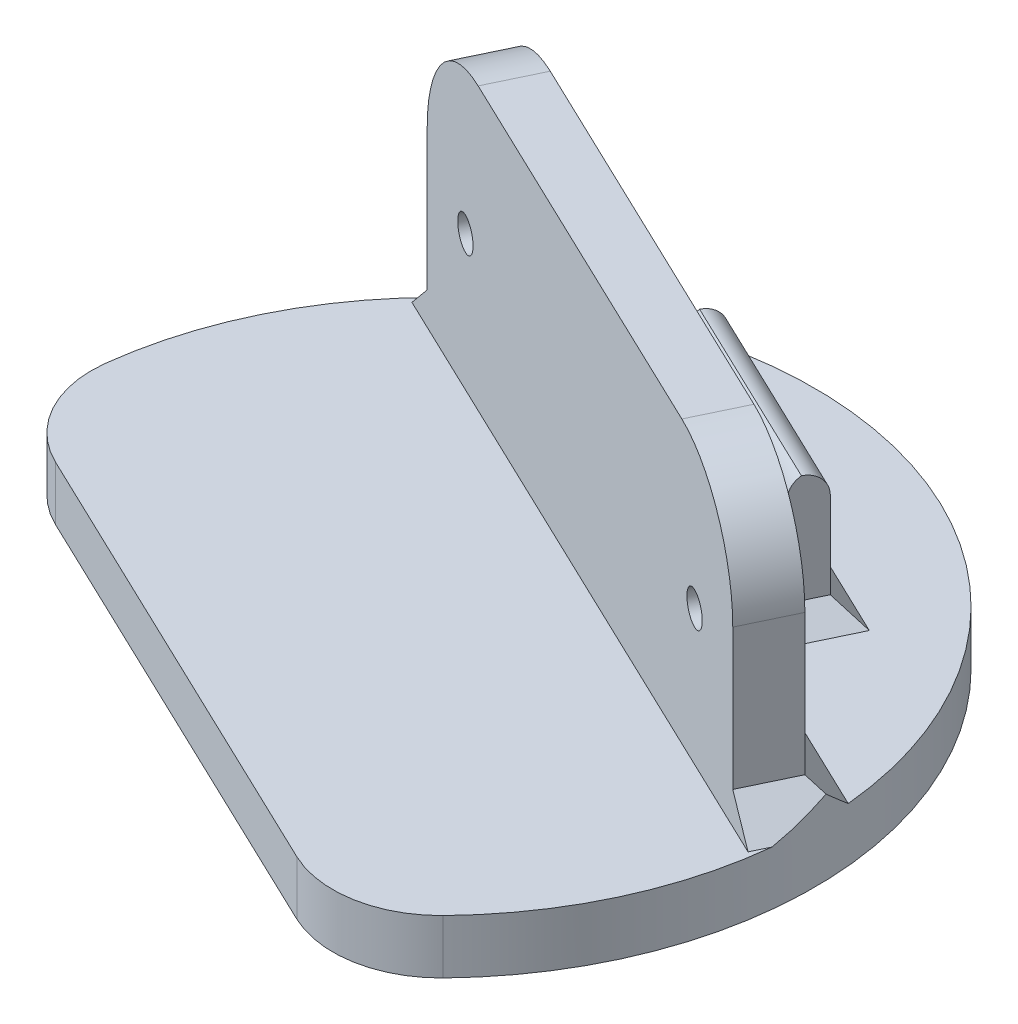
from build123d import *

# Parameters (mm, degrees)
ESBO_O1_R                 = 35
RESSALTO_EXTRUS_O1_DEPTH  = 5
ESBO_O3_R                 = 6
RESSALTO_EXTRUS_O3_DEPTH  = 13
ESBO_O4_R                 = 2.5
CORTE_EXTRUS_O1_DEPTH     = 13
RESSALTO_EXTRUS_O5_DEPTH  = 13
CORTE_EXTRUS_O6_START     = -7
CORTE_EXTRUS_O6_OUTLINE_R = 2
CORTE_EXTRUS_O6_DEPTH     = 14
CORTE_EXTRUS_O8_DEPTH     = 68.852738868
RESSALTO_EXTRUS_O7_DEPTH  = 26
ESBO_O19_R                = 1.5
CORTE_EXTRUS_O9_DEPTH     = 26
FILETE1_R                 = 10
FILETE2_R                 = 10
RESSALTO_EXTRUS_O9_DEPTH  = 12
CORTE_EXTRUS_O11_REACH    = 75.407
ESBO_O26_R                = 3
CHANFRO7_SIZE             = 3
CHANFRO8_SIZE             = 3
CHANFRO9_SIZE             = 3
CHANFRO10_SIZE            = 2
FILETE5_R                 = 2
FILETE6_R                 = 2
CHANFRO11_SIZE            = 2
RESSALTO_EXTRUS_O10_DEPTH = 1


with BuildPart() as part:
    # Esboço1 → Ressalto-extrusão1 (new body)
    with BuildSketch(Plane(origin=(0, 0, 0), x_dir=(1, 0, 0), z_dir=(0, 1, 0))):
        with Locations(Location((0, 0, 0), (0, 0, 270))):
            Circle(ESBO_O1_R)
    extrude(amount=RESSALTO_EXTRUS_O1_DEPTH)

    # Esboço3 → Ressalto-extrusão3 (add)
    with BuildSketch(Plane.XZ):
        with Locations(Location((0, 0, 0), (0, 0, 90))):
            Circle(ESBO_O3_R)
    extrude(amount=RESSALTO_EXTRUS_O3_DEPTH)

    # Esboço4 → Corte-extrusão1 (cut)
    with BuildSketch(Plane(origin=(0, -13, 0), x_dir=(-1, 0, 0), z_dir=(0, -1, 0))):
        with Locations(Location((0, 0, 0), (0, 0, 90))):
            Circle(ESBO_O4_R)
    extrude(amount=-CORTE_EXTRUS_O1_DEPTH, mode=Mode.SUBTRACT)

    # Esboço11 → Ressalto-extrusão5 (add)
    with BuildSketch(Plane.XZ):
        Polygon((11.986630115, -25.30475644), (12.417946194, -26.206957327), (16.026749741, -24.481693012), (18.22200413, -23.432205555), (17.359371973, -21.627803781), (15.164117584, -22.677291238), (11.555314036, -24.402555553), align=None)
    extrude(amount=RESSALTO_EXTRUS_O5_DEPTH)

    # Corte-extrusão6: read off the stored shape, not the designer's step
    # Corte-extrusão6 outline → Corte-extrusão6 (cut)
    with BuildSketch(Plane(origin=(0, 0, 0), x_dir=(0.9022008868624046, 0, 0.43131607869947386), z_dir=(0.43131607869947386, 0, -0.9022008868624045)).offset(CORTE_EXTRUS_O6_START)):
        with Locations((0, 7.014981428)):
            Circle(CORTE_EXTRUS_O6_OUTLINE_R)
    extrude(amount=CORTE_EXTRUS_O6_DEPTH, mode=Mode.SUBTRACT)

    # 3DSketch5 → Corte-extrusão8 (cut, through all)
    with BuildSketch(Plane(origin=(-8.247671749, -6.480100675, 16.008238046), x_dir=(0.7047714310013795, 0.6243195323179013, 0.3369307816312202), z_dir=(-0.43131607869947175, 0, 0.9022008868624055))):
        Polygon((0, 0), (-30.606987597, 24.461465293), (-10.703733889, 49.365069068), (51.063459474, 0), (31.160205765, -24.903603774), align=None)
    extrude(amount=CORTE_EXTRUS_O8_DEPTH, mode=Mode.SUBTRACT)

    # Esboço18 → Ressalto-extrusão7 (add)
    with BuildSketch(Plane(origin=(0, 5, 0), x_dir=(1, 0, 0), z_dir=(0, 1, 0))):
        Polygon((4.313160787, 9.022008869), (31.379187393, -3.917473492), (33.535767786, 0.593530942), (-20.596285425, 26.472495664), (-22.752865819, 21.96149123), align=None)
    extrude(amount=RESSALTO_EXTRUS_O7_DEPTH)

    # Esboço19 → Corte-extrusão9 (cut)
    with BuildSketch(Plane(origin=(4.313160787, 0, -9.022008869), x_dir=(0.9022008868624055, 0, 0.43131607869947175), z_dir=(-0.43131607869947175, 0, 0.9022008868624055))):
        with Locations((-22.5, 17.5)):
            Circle(ESBO_O19_R)
        with Locations((22.5, 17.5)):
            Circle(ESBO_O19_R)
    extrude(amount=-CORTE_EXTRUS_O9_DEPTH, mode=Mode.SUBTRACT)

    # Filete1
    filete1_edges = [part.edges().sort_by_distance(p)[0] for p in [
        (32.45747759, 31, 1.661971275),
        (-21.674575622, 31, -24.216993447),
    ]]
    fillet(filete1_edges, radius=FILETE1_R)

    # Filete2
    filete2_edges = [part.edges().sort_by_distance(p)[0] for p in [
        (19.317369696, 2.5, 29.18628493),
        (-34.844748529, 2.5, 3.292946997),
    ]]
    fillet(filete2_edges, radius=FILETE2_R)

    # Esboço25 → Ressalto-extrusão9 (add)
    with BuildSketch(Plane(origin=(0, 5, 0), x_dir=(1, 0, 0), z_dir=(0, 1, 0))):
        Polygon((8.981926733, 18.787851102), (-0.040082135, 23.101011889), (1.253866101, 25.80761455), (19.297883838, 17.181292976), (18.003935602, 14.474690315), align=None)
    extrude(amount=RESSALTO_EXTRUS_O9_DEPTH)

    # Esboço26 → Corte-extrusão11 (cut, up to next)
    with BuildSketch(Plane(origin=(10.275874969, 0, -21.494453763), x_dir=(-0.902200886862406, 0, -0.4313160786994711), z_dir=(0.4313160786994711, 0, -0.902200886862406)), mode=Mode.PRIVATE) as corte_extrus_o11_sk1:
        with Locations((0, 11)):
            Circle(ESBO_O26_R)
    corte_extrus_o11_tool1 = extrude(corte_extrus_o11_sk1.sketch, amount=-CORTE_EXTRUS_O11_REACH, mode=Mode.PRIVATE) & part.part
    add(corte_extrus_o11_tool1.solids().sort_by_distance((10.275875, 11, -21.494454))[0], mode=Mode.SUBTRACT)

    # Chanfro7
    chanfro7_edges = [part.edges().sort_by_distance(p)[0] for p in [
        (6.46974118, 5, -13.533013303),
    ]]
    chamfer(chanfro7_edges, length=CHANFRO7_SIZE)

    # Chanfro8
    # the kernel refuses this chamfer: 3 mm, written as the material it adds along each edge
    with BuildSketch(Plane(origin=(38.157340689, 5, -10.26065762), x_dir=(0.9022008868624055, 0, 0.43131607869947186), z_dir=(-0.4313160786994719, 0, 0.9022008868624055))) as chanfro8_piece_1_section:
        Polygon((CHANFRO8_SIZE, 0), (0, CHANFRO8_SIZE), (0, 0), align=None)
    chanfro8_piece_1 = extrude(amount=15.715048964, mode=Mode.PRIVATE)
    chanfro8_piece_1 = split(chanfro8_piece_1, bisect_by=Plane(origin=(36.493528356, 1.142475518, -6.780395611), z_dir=(-0.30498652408318644, -0.7071067811865479, 0.6379523650929244)), keep=Keep.TOP, mode=Mode.PRIVATE)
    chanfro8_piece_1 = chanfro8_piece_1 & Plane(origin=(0, 5, 0), x_dir=(0, 0, 1), z_dir=(0, -1, 0)) * Cylinder(35, 44, mode=Mode.PRIVATE)
    chanfro8_piece_1 = split(chanfro8_piece_1, bisect_by=Plane(origin=(33.535767786, 5, -0.593530942), z_dir=(0.4313160786994711, 0, -0.9022008868624058)), keep=Keep.TOP, mode=Mode.PRIVATE)
    add(chanfro8_piece_1)
    with BuildSketch(Plane(origin=(38.157340689, 5, -10.26065762), x_dir=(0.9022008868624055, 0, 0.43131607869947186), z_dir=(-0.4313160786994719, 0, 0.9022008868624055))) as chanfro8_piece_2_section:
        Polygon((CHANFRO8_SIZE, 0), (0, CHANFRO8_SIZE), (0, 0), align=None)
    chanfro8_piece_2 = extrude(amount=15.715048964, mode=Mode.PRIVATE)
    chanfro8_piece_2 = split(chanfro8_piece_2, bisect_by=Plane(origin=(36.493528356, 1.142475518, -6.780395611), z_dir=(-0.30498652408318644, -0.7071067811865479, 0.6379523650929244)), keep=Keep.TOP, mode=Mode.PRIVATE)
    chanfro8_piece_2 = chanfro8_piece_2 & Plane(origin=(0, 5, 0), x_dir=(0, 0, 1), z_dir=(0, -1, 0)) * Cylinder(35, 44, mode=Mode.PRIVATE)
    chanfro8_piece_2 = split(chanfro8_piece_2, bisect_by=Plane(origin=(33.535767786, 5, -0.593530942), z_dir=(-0.4313160786994711, 0, 0.9022008868624058)), keep=Keep.TOP, mode=Mode.PRIVATE)
    add(chanfro8_piece_2)

    # Chanfro9
    # the kernel refuses this chamfer: 3 mm, written as the material it adds along each edge
    with BuildSketch(Plane(origin=(-22.752865819, 5, -21.96149123), x_dir=(0, 1, 0), z_dir=(0.431316078699471, 0, -0.902200886862406))) as chanfro9_piece_1_section:
        Polygon((CHANFRO9_SIZE, 0), (0, -CHANFRO9_SIZE), (0, 0), align=None)
    chanfro9_piece_1 = extrude(amount=15.715048964, mode=Mode.PRIVATE)
    chanfro9_piece_1 = split(chanfro9_piece_1, bisect_by=Plane(origin=(-20.596285425, 5, -26.472495664), z_dir=(-0.4313160786994711, 0, 0.9022008868624058)), keep=Keep.TOP, mode=Mode.PRIVATE)
    chanfro9_piece_1 = split(chanfro9_piece_1, bisect_by=Plane(origin=(-21.027601504, 9, -25.570294777), z_dir=(-0.30498652408290505, -0.7071067811867798, 0.6379523650928014)), keep=Keep.TOP, mode=Mode.PRIVATE)
    chanfro9_piece_1 = chanfro9_piece_1 & Plane(origin=(0, 5, 0), x_dir=(0, 0, 1), z_dir=(0, -1, 0)) * Cylinder(35, 44, mode=Mode.PRIVATE)
    add(chanfro9_piece_1)
    with BuildSketch(Plane(origin=(-22.752865819, 5, -21.96149123), x_dir=(0, 1, 0), z_dir=(0.431316078699471, 0, -0.902200886862406))) as chanfro9_piece_2_section:
        Polygon((CHANFRO9_SIZE, 0), (0, -CHANFRO9_SIZE), (0, 0), align=None)
    chanfro9_piece_2 = extrude(amount=15.715048964, mode=Mode.PRIVATE)
    chanfro9_piece_2 = split(chanfro9_piece_2, bisect_by=Plane(origin=(-20.596285425, 5, -26.472495664), z_dir=(0.4313160786994711, 0, -0.9022008868624058)), keep=Keep.TOP, mode=Mode.PRIVATE)
    chanfro9_piece_2 = split(chanfro9_piece_2, bisect_by=Plane(origin=(-21.027601504, 9, -25.570294777), z_dir=(-0.30498652408290505, -0.7071067811867798, 0.6379523650928014)), keep=Keep.TOP, mode=Mode.PRIVATE)
    chanfro9_piece_2 = chanfro9_piece_2 & Plane(origin=(0, 5, 0), x_dir=(0, 0, 1), z_dir=(0, -1, 0)) * Cylinder(35, 44, mode=Mode.PRIVATE)
    add(chanfro9_piece_2)

    # Chanfro10
    chanfro10_edges = [part.edges().sort_by_distance(p)[0] for p in [
        (18.65090972, 5, -15.827991645),
        (10.275874969, 5, -21.494453763),
        (0.606891983, 5, -24.454313219),
        (8.981926733, 5, -18.787851102),
    ]]
    chamfer(chanfro10_edges, length=CHANFRO10_SIZE)

    # Filete5
    filete5_edges = [part.edges().sort_by_distance(p)[0] for p in [
        (10.275874969, 17, -21.494453763),
    ]]
    fillet(filete5_edges, radius=FILETE5_R)

    # Filete6
    # the kernel refuses this fillet: 2 mm, written as the material it takes off along each edge
    with BuildSketch(Plane(origin=(21.910580039, 17, -12.607036909), x_dir=(0.4313160786994712, -7.460698725480719e-14, -0.9022008868624058), z_dir=(-0.9022008868624058, 0, -0.4313160786994712))) as filete6_piece_1:
        with BuildLine():
            CenterArc((2, 1.732050808), FILETE6_R, 180, 60)
            Line((0, 1.732050808), (-0.04, 1.732050808))
            Line((-0.04, 1.732050808), (-0.04, 0))
            Line((-0.04, 0), (0, -0.04))
            ThreePointArc((0, -0.04), (0.5, -0.04), (0.98, -0.034641016))
            Line((0.98, -0.034641016), (1, 0))
        make_face()
    extrude(amount=28.660254038, mode=Mode.SUBTRACT)

    # Chanfro11
    chanfro11_edges = [part.edges().sort_by_distance(p)[0] for p in [
        (11.986630115, 0, -25.30475644),
        (15.319975162, 0, -24.819581441),
        (17.790688052, 0, -22.530004668),
        (14.457343005, 0, -23.015179667),
    ]]
    chamfer(chanfro11_edges, length=CHANFRO11_SIZE)

    # Esboço29 → Ressalto-extrusão10 (add)
    # profile 1 of 4: a face of its own
    with BuildSketch(Plane.XZ):
        Polygon((-1.172621061, 9.365732647), (-0.459580196, 9.437948192), (-0.10972042, 5.989130083), (-0.822761285, 5.916914538), align=None)
    # profile 2 of 4: a face of its own
    with BuildSketch(Plane.XZ):
        Polygon((-9.264611029, -0.759565999), (-9.210624651, -0.07246664), (-6.792455581, 1.36483304), (-9.083020484, 1.545021341), (-9.026930741, 2.262970059), (-5.545861029, 1.988831437), (-5.599847408, 1.298927591), (-8.01100526, -0.136268723), (-5.727451574, -0.315755903), (-5.783541318, -1.033704621), align=None)
    # profile 3 of 4: a face of its own
    with BuildSketch(Plane.XZ):
        Polygon((1.854040231, -8.955612425), (1.151516193, -8.980852809), (0.190278212, -6.585119636), (-0.604793903, -9.045356014), (-1.296801115, -9.071297521), (-2.061023871, -5.613364829), (-1.36901666, -5.588124444), (-0.883139256, -7.771417713), (-0.160983807, -5.543953771), (0.472129174, -5.52011563), (1.344324687, -7.689386463), (1.676656417, -5.475944957), (2.376375969, -5.450704572), align=None)
    # profile 4 of 4: a face of its own
    with BuildSketch(Plane.XZ):
        with BuildLine():
            add(Edge.make_bspline(
                [(8.996207092, 1.762616947), (9.007675083, 1.697808087), (9.030293252, 1.569986412), (9.043314002, 1.377868468), (9.038386134, 1.189408294), (9.016297609, 1.004486794), (8.974953835, 0.823110898), (8.916711254, 0.6453441), (8.840458643, 0.471106775), (8.746922467, 0.30322613), (8.640592137, 0.144191668), (8.520408826, 0.0004984), (8.390711819, -0.128037082), (8.249417061, -0.239414921), (8.097713171, -0.334927305), (7.934826831, -0.413306147), (7.761376247, -0.476902181), (7.6401367, -0.504706767), (7.578538823, -0.518833374)],
                knots=[0, 0, 0, 0, 1.056993123, 2.084693837, 3.087726804, 4.082677694, 5.072085085, 6.072020004, 7.084394713, 8.123219308, 9.156462809, 10.153700254, 11.128286591, 12.085461095, 13.03884146, 14.00292335, 14.985350203, 16, 16, 16, 16], degree=3))
            add(Edge.make_bspline(
                [(7.578538823, -0.518833374), (7.516997601, -0.529411818), (7.395674876, -0.550266226), (7.213231224, -0.55991236), (7.034580162, -0.550189358), (6.859561126, -0.52097469), (6.687874592, -0.474022258), (6.519864705, -0.407763212), (6.356675648, -0.320850005), (6.198222726, -0.218280787), (6.049029733, -0.100334901), (5.912493613, 0.029350297), (5.791223937, 0.170415292), (5.684961109, 0.322071365), (5.592479163, 0.484064436), (5.51538672, 0.65715782), (5.453159397, 0.841059241), (5.424051316, 0.968649909), (5.409267989, 1.03345028)],
                knots=[0, 0, 0, 0, 1.00875401, 1.988663582, 2.945939463, 3.895580966, 4.851514034, 5.81824811, 6.808524318, 7.835451495, 8.865632698, 9.878375861, 10.874944891, 11.867510093, 12.867489042, 13.885538443, 14.926113527, 16, 16, 16, 16], degree=3))
            add(Edge.make_bspline(
                [(5.409267989, 1.03345028), (5.396957461, 1.101985496), (5.372833907, 1.236286231), (5.359773972, 1.437562153), (5.362315874, 1.633314681), (5.385045984, 1.823774764), (5.425501497, 2.00883833), (5.486090271, 2.187669433), (5.563059778, 2.361908834), (5.659168892, 2.527907374), (5.767796981, 2.683855143), (5.888480923, 2.825036575), (6.018689078, 2.950576014), (6.158416812, 3.060495928), (6.308205663, 3.153831426), (6.467800613, 3.230187744), (6.636665938, 3.292423244), (6.754593441, 3.319445001), (6.814316066, 3.333129767)],
                knots=[0, 0, 0, 0, 1.112877688, 2.180780943, 3.220067574, 4.240058739, 5.243081267, 6.244242504, 7.254904034, 8.284608484, 9.307062242, 10.29062478, 11.25023016, 12.195370806, 13.128842648, 14.06671196, 15.0209151, 16, 16, 16, 16], degree=3))
            add(Edge.make_bspline(
                [(6.814316066, 3.333129767), (6.854895593, 3.340485442), (6.935464158, 3.355089757), (7.057125317, 3.366672651), (7.177742255, 3.370258271), (7.297768419, 3.365609078), (7.416666096, 3.351072517), (7.534946225, 3.329856811), (7.651892389, 3.298314344), (7.767657124, 3.25941934), (7.880979093, 3.212461909), (7.99095673, 3.158351323), (8.096422005, 3.096673975), (8.198192709, 3.028240273), (8.295529738, 2.952708568), (8.388295171, 2.86930971), (8.47745844, 2.779604664), (8.562021366, 2.683149272), (8.64056464, 2.581284358), (8.713597804, 2.475680153), (8.778450066, 2.365894724), (8.836158788, 2.252170545), (8.887489982, 2.135540977), (8.930896858, 2.014515312), (8.968537907, 1.890414567), (8.986966544, 1.80529692), (8.996207092, 1.762616947)],
                knots=[0, 0, 0, 0, 0.993249742, 1.972046358, 2.940929659, 3.898953648, 4.862768049, 5.824689146, 6.79165628, 7.778099735, 8.765201842, 9.744759355, 10.728837678, 11.706451302, 12.697592095, 13.694521762, 14.709807119, 15.743229533, 16.782769641, 17.807318403, 18.834787279, 19.852131535, 20.878365398, 21.902542756, 22.948286042, 24, 24, 24, 24], degree=3))
        make_face()
        with BuildLine():
            add(Edge.make_bspline(
                [(8.35888738, 1.641322876), (8.349638484, 1.683138861), (8.331429284, 1.765466053), (8.290721023, 1.883538049), (8.241891831, 1.9947226), (8.183358985, 2.098670549), (8.114965499, 2.195013683), (8.037455546, 2.284438219), (7.950994905, 2.366853132), (7.855786815, 2.440539983), (7.755167737, 2.505826463), (7.649222444, 2.558629117), (7.539983604, 2.599638566), (7.427362294, 2.62842601), (7.311275301, 2.645366598), (7.19192951, 2.650190321), (7.069031962, 2.642543925), (6.987152165, 2.628133595), (6.945425842, 2.620790024)],
                knots=[0, 0, 0, 0, 1.068431478, 2.103524882, 3.111812557, 4.096770442, 5.076182739, 6.056480966, 7.04695339, 8.053010262, 9.058085368, 10.036576144, 11.002179037, 11.965876272, 12.932941146, 13.925662247, 14.942907875, 16, 16, 16, 16], degree=3))
            add(Edge.make_bspline(
                [(6.945425842, 2.620790024), (6.89955976, 2.61012143), (6.809933552, 2.589274094), (6.682865882, 2.541411153), (6.565497081, 2.482748389), (6.458684774, 2.410679364), (6.362739384, 2.325665705), (6.276635083, 2.228726005), (6.200109672, 2.119747425), (6.159227555, 2.039638757), (6.138434656, 1.998894992)],
                knots=[0, 0, 0, 0, 1.065893573, 2.082846319, 3.067913113, 4.03275039, 4.993087869, 5.964412104, 6.96468735, 8, 8, 8, 8], degree=3))
            add(Edge.make_bspline(
                [(6.138434656, 1.998894992), (6.123617141, 1.96593276), (6.094215975, 1.900528537), (6.060261495, 1.799052043), (6.033532836, 1.69658269), (6.018129371, 1.591968778), (6.009090248, 1.486082814), (6.010374142, 1.378462697), (6.018857975, 1.269334757), (6.032152286, 1.196956023), (6.038875361, 1.160353325)],
                knots=[0, 0, 0, 0, 1.008295335, 2.000676833, 2.983317033, 3.960484081, 4.948739413, 5.946958437, 6.961754967, 8, 8, 8, 8], degree=3))
            add(Edge.make_bspline(
                [(6.038875361, 1.160353325), (6.04818843, 1.119488237), (6.066506077, 1.039111697), (6.106329453, 0.923400123), (6.155261482, 0.814288717), (6.214481482, 0.712246056), (6.283022052, 0.61710324), (6.360286854, 0.528147469), (6.448052116, 0.446638958), (6.543810523, 0.372161818), (6.646059184, 0.307547424), (6.751801817, 0.253705079), (6.860226332, 0.211780974), (6.971865724, 0.183276485), (7.085733024, 0.165496484), (7.202298664, 0.159843363), (7.32141749, 0.166965851), (7.400784458, 0.180379449), (7.441118951, 0.187196274)],
                knots=[0, 0, 0, 0, 1.057548477, 2.080066199, 3.083561631, 4.072308226, 5.053153701, 6.040050012, 7.04193092, 8.072266727, 9.098624617, 10.090798299, 11.063857395, 12.026991093, 12.994164769, 13.968868272, 14.967773729, 16, 16, 16, 16], degree=3))
            add(Edge.make_bspline(
                [(7.441118951, 0.187196274), (7.480850962, 0.19617004), (7.559121139, 0.213847933), (7.671282566, 0.254656038), (7.776687934, 0.304860696), (7.874866545, 0.365941987), (7.966427691, 0.435947399), (8.050436997, 0.516931925), (8.12789538, 0.607675692), (8.197044309, 0.70806341), (8.257973974, 0.814291212), (8.306958993, 0.924881936), (8.345621449, 1.037804305), (8.371214146, 1.153789821), (8.386097944, 1.272329097), (8.389536332, 1.393225092), (8.38136747, 1.517044176), (8.366476624, 1.599366577), (8.35888738, 1.641322876)],
                knots=[0, 0, 0, 0, 1.020036242, 2.009422978, 2.984030185, 3.94146462, 4.902172466, 5.867458659, 6.860497271, 7.887422614, 8.91838278, 9.925283362, 10.914427317, 11.904923154, 12.896647947, 13.90457028, 14.932046759, 16, 16, 16, 16], degree=3))
        make_face(mode=Mode.SUBTRACT)
    extrude(amount=RESSALTO_EXTRUS_O10_DEPTH)


solid = part.part
